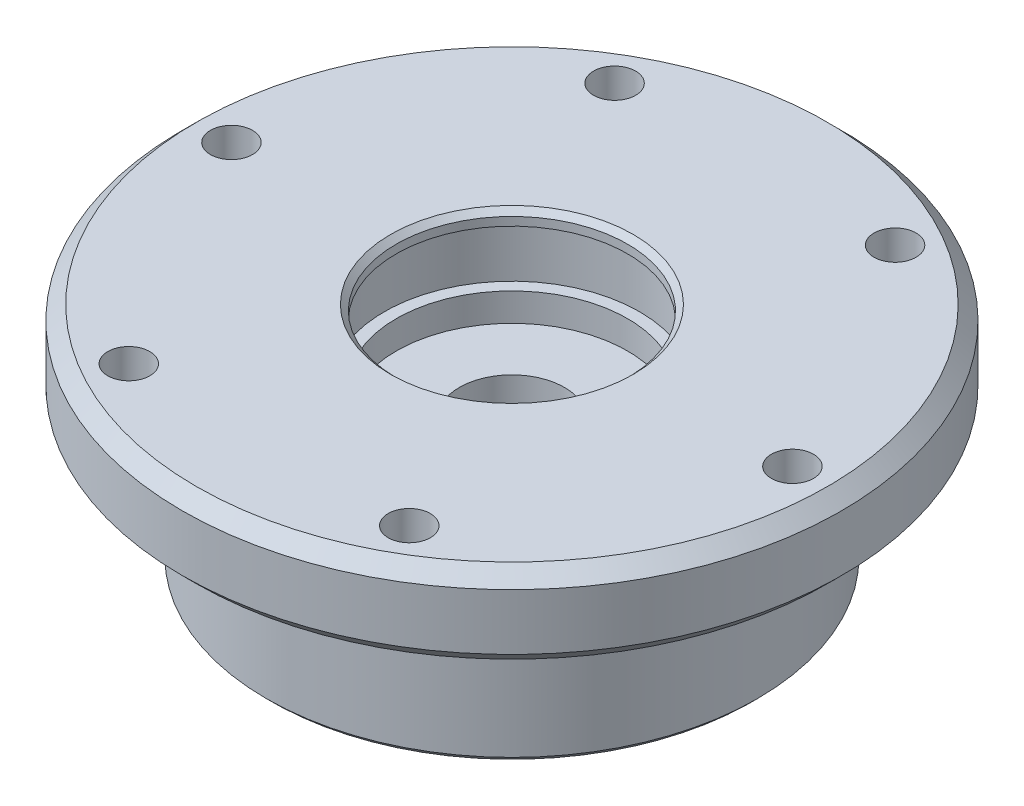
from build123d import *

# Parameters (mm, degrees)
SKETCH1_R           = 23.5
SKETCH1_R_2         = 1.5
SKETCH1_R_3         = 8.25
BOSS_EXTRUDE1_DEPTH = 3
SKETCH2_R           = 9.1
CUT_EXTRUDE1_DEPTH  = 2
SKETCH3_R           = 21.5
SKETCH3_R_2         = 18.5
BOSS_EXTRUDE2_DEPTH = 1
SKETCH4_R           = 17.5
SKETCH4_R_2         = 3.75
BOSS_EXTRUDE3_DEPTH = 10
SKETCH5_R           = 19
SKETCH5_R_2         = 17.5
BOSS_EXTRUDE4_DEPTH = 0.5
CHAMFER1_SIZE       = 1
CHAMFER3_SIZE       = 0.4
SKETCH6_R           = 2.35
CUT_EXTRUDE2_DEPTH  = 4
SKETCH7_R           = 1.75
CUT_EXTRUDE3_DEPTH  = 8
CHAMFER4_SIZE       = 0.4
CUT_EXTRUDE4_START  = -1
SKETCH8_R           = 8.25
CUT_EXTRUDE4_DEPTH  = 1


with BuildPart() as part:
    # Sketch1 → Boss-Extrude1 (new, symmetric)
    with BuildSketch(Plane(origin=(0, 0, 0), x_dir=(1, 0, 0), z_dir=(0, 1, 0))):
        Circle(SKETCH1_R)
        with Locations((20, 0)):
            Circle(SKETCH1_R_2, mode=Mode.SUBTRACT)
        with Locations((10, -17.320508076)):
            Circle(SKETCH1_R_2, mode=Mode.SUBTRACT)
        with Locations((-10, -17.320508076)):
            Circle(SKETCH1_R_2, mode=Mode.SUBTRACT)
        with Locations((-20, 0)):
            Circle(SKETCH1_R_2, mode=Mode.SUBTRACT)
        with Locations((-10, 17.320508076)):
            Circle(SKETCH1_R_2, mode=Mode.SUBTRACT)
        with Locations((10, 17.320508076)):
            Circle(SKETCH1_R_2, mode=Mode.SUBTRACT)
        Circle(SKETCH1_R_3, mode=Mode.SUBTRACT)
    extrude(amount=BOSS_EXTRUDE1_DEPTH, both=True)

    # Sketch2 → Cut-Extrude1 (cut, symmetric)
    with BuildSketch(Plane(origin=(0, 0, 0), x_dir=(1, 0, 0), z_dir=(0, 1, 0))):
        Circle(SKETCH2_R)
    extrude(amount=CUT_EXTRUDE1_DEPTH, both=True, mode=Mode.SUBTRACT)

    # Sketch3 → Boss-Extrude2 (add)
    with BuildSketch(Plane(origin=(0, -3, 0), x_dir=(1, 0, 0), z_dir=(0, 1, 0))):
        Circle(SKETCH3_R)
        Circle(SKETCH3_R_2, mode=Mode.SUBTRACT)
    extrude(amount=BOSS_EXTRUDE2_DEPTH)

    # Sketch4 → Boss-Extrude3 (add)
    with BuildSketch(Plane.XZ.offset(3)):
        Circle(SKETCH4_R)
        Circle(SKETCH4_R_2, mode=Mode.SUBTRACT)
    extrude(amount=BOSS_EXTRUDE3_DEPTH)

    # Sketch5 → Boss-Extrude4 (add)
    with BuildSketch(Plane.XZ.offset(3)):
        Circle(SKETCH5_R)
        Circle(SKETCH5_R_2, mode=Mode.SUBTRACT)
    extrude(amount=BOSS_EXTRUDE4_DEPTH)

    # Chamfer1
    chamfer1_edges = [part.edges().sort_by_distance(p)[0] for p in [
        (-23.5, -3, 0),
        (-23.5, 3, 0),
    ]]
    chamfer(chamfer1_edges, length=CHAMFER1_SIZE)

    # Chamfer3
    chamfer3_edges = [part.edges().sort_by_distance(p)[0] for p in [
        (-8.25, 3, 0),
    ]]
    chamfer(chamfer3_edges, length=CHAMFER3_SIZE)

    # Sketch6 → Cut-Extrude2 (cut)
    with BuildSketch(Plane.XZ.offset(13)):
        with Locations((7.5, 0)):
            Circle(SKETCH6_R)
        with Locations((0, 7.5)):
            Circle(SKETCH6_R)
        with Locations((-7.5, 0)):
            Circle(SKETCH6_R)
        with Locations((0, -7.5)):
            Circle(SKETCH6_R)
    extrude(amount=-CUT_EXTRUDE2_DEPTH, mode=Mode.SUBTRACT)

    # Sketch7 → Cut-Extrude3 (cut)
    with BuildSketch(Plane.XZ.offset(13)):
        with Locations((0, 7.5)):
            Circle(SKETCH7_R)
        with Locations((7.5, 0)):
            Circle(SKETCH7_R)
        with Locations((0, -7.5)):
            Circle(SKETCH7_R)
        with Locations((-7.5, 0)):
            Circle(SKETCH7_R)
    extrude(amount=-CUT_EXTRUDE3_DEPTH, mode=Mode.SUBTRACT)

    # Chamfer4
    chamfer4_edges = [part.edges().sort_by_distance(p)[0] for p in [
        (-17.5, -13, 0),
    ]]
    chamfer(chamfer4_edges, length=CHAMFER4_SIZE)

    # Sketch8 → Cut-Extrude4 (cut)
    with BuildSketch(Plane(origin=(0, -3, 0), x_dir=(1, 0, 0), z_dir=(0, 1, 0)).offset(CUT_EXTRUDE4_START)):
        Circle(SKETCH8_R)
    extrude(amount=CUT_EXTRUDE4_DEPTH, mode=Mode.SUBTRACT)


solid = part.part
